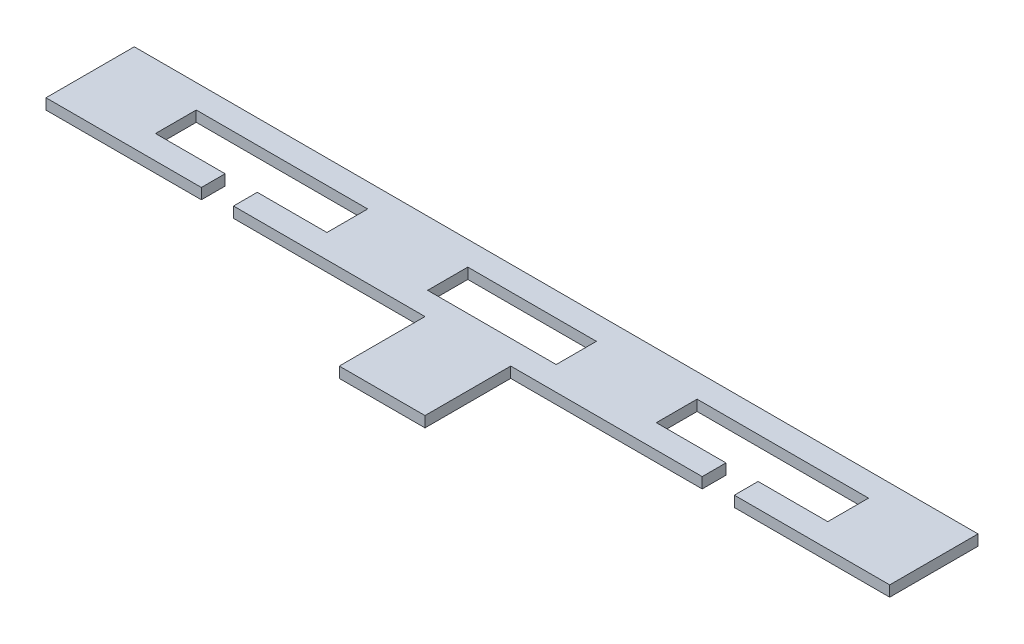
from build123d import *

# Parameters (mm, degrees)
SKETCH1_W           = 152.4
SKETCH1_H           = 47.642564479
BOSS_EXTRUDE1_DEPTH = 12.7


with BuildPart() as part:
    # Sketch1 → Boss-Extrude1 (new body)
    with BuildSketch(Plane(origin=(0, 0, 0), x_dir=(1, 0, 0), z_dir=(0, 1, 0))):
        Polygon((0, 0), (0, 104.642970986), (1000.00054, 104.642970986), (1000.00054, 0), (815.85054, 0), (815.85054, 28.162027155), (898.40054, 28.162027155), (898.40054, 76.48094383), (695.20054, 76.48094383), (695.20054, 28.162027155), (777.75054, 28.162027155), (777.75054, 0), (550.80027, 0), (550.80027, -101.6), (449.20027, -101.6), (449.20027, 0), (222.25, 0), (222.25, 28.162027155), (304.8, 28.162027155), (304.8, 76.48094383), (101.6, 76.48094383), (101.6, 28.162027155), (184.15, 28.162027155), (184.15, 0), align=None)
        with Locations((500.00027, 52.321485493)):
            Rectangle(SKETCH1_W, SKETCH1_H, mode=Mode.SUBTRACT)
    extrude(amount=BOSS_EXTRUDE1_DEPTH)


solid = part.part
